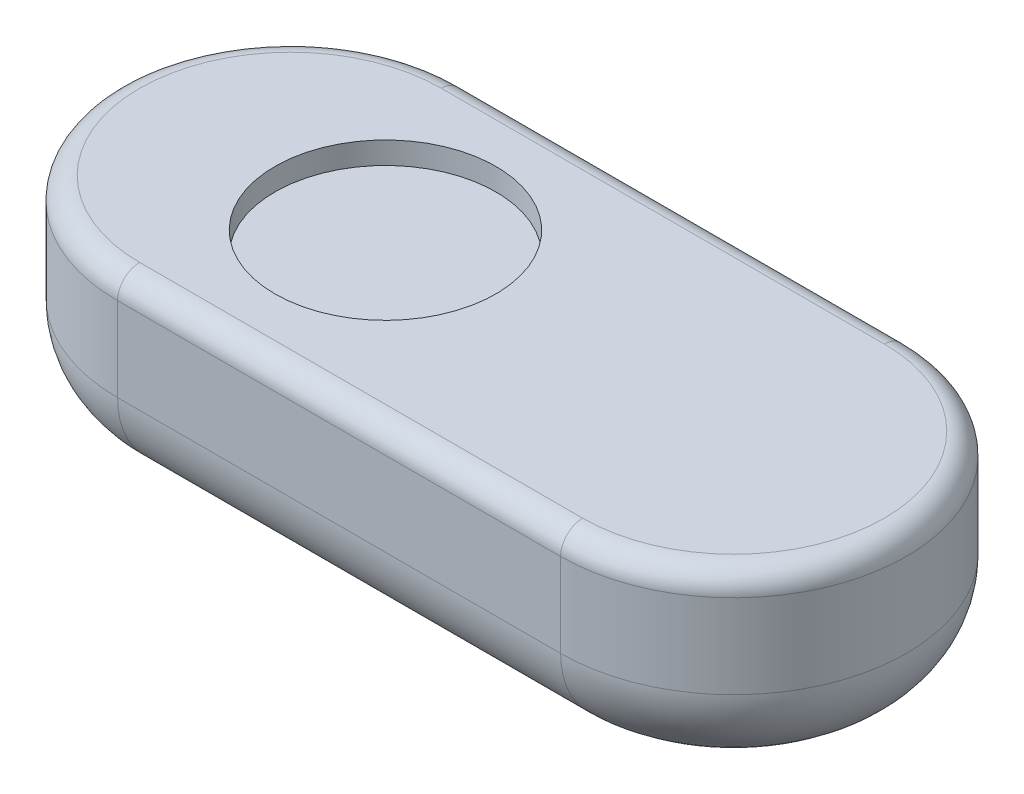
from build123d import *

# Parameters (mm, degrees)
EXTRUDE_1_DEPTH     = 17.6
FILLET_2_R          = 2
FILLET_3_R          = 8
SKETCH_2_R          = 10
CUT_EXTRUDE_1_DEPTH = 2


with BuildPart() as part:
    # 草圖1 → 填料-伸長1 (new body)
    with BuildSketch(Plane(origin=(0, 0, 0), x_dir=(1, 0, 0), z_dir=(0, 1, 0))):
        with BuildLine():
            Line((-20.05, 15.65), (20.05, 15.65))
            ThreePointArc((20.05, 15.65), (35.7, 0), (20.05, -15.65))
            Line((20.05, -15.65), (-20.05, -15.65))
            ThreePointArc((-20.05, -15.65), (-35.7, 0), (-20.05, 15.65))
        make_face()
    extrude(amount=EXTRUDE_1_DEPTH)

    # 圓角2
    fillet_2_edges = [part.edges().sort_by_distance(p)[0] for p in [
        (-35.7, 17.6, 0),
        (0, 17.6, 15.65),
        (35.7, 17.6, 0),
        (0, 17.6, -15.65),
    ]]
    fillet(fillet_2_edges, radius=FILLET_2_R)

    # 圓角3
    fillet_3_edges = [part.edges().sort_by_distance(p)[0] for p in [
        (0, 0, 15.65),
        (35.7, 0, 0),
        (0, 0, -15.65),
        (-35.7, 0, 0),
    ]]
    fillet(fillet_3_edges, radius=FILLET_3_R)

    # 草圖2 → 除料-伸長1 (cut)
    with BuildSketch(Plane(origin=(0, 17.6, 0), x_dir=(1, 0, 0), z_dir=(0, 1, 0))):
        with Locations((-11.455400627, 0)):
            Circle(SKETCH_2_R)
    extrude(amount=-CUT_EXTRUDE_1_DEPTH, mode=Mode.SUBTRACT)


solid = part.part
